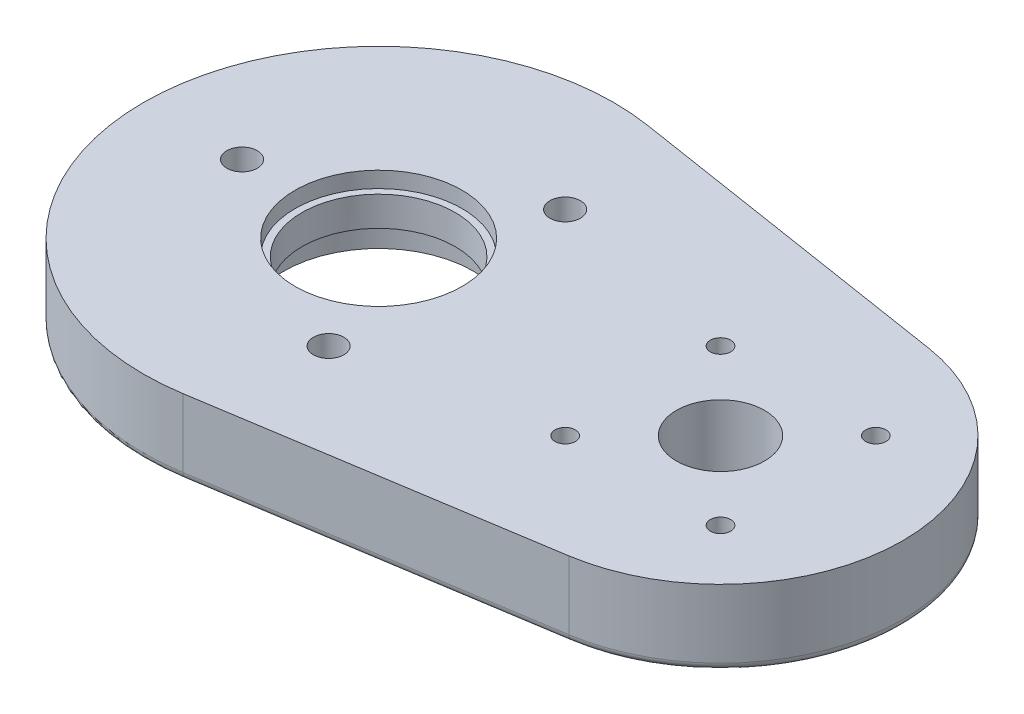
from build123d import *

# Parameters (mm, degrees)
BOSS_EXTRUDE1_DEPTH                          = 12.7
SKETCH2_R                                    = 12.827
SKETCH2_R_2                                  = 7.366
CUT_EXTRUDE1_DEPTH                           = 106.08145771
CBORE_FOR_10_SOCKET_HEAD_CAP_SCREW1_AT_COUNT = 2
CBORE_FOR_10_SOCKET_HEAD_CAP_SCREW1_AT_PITCH = 39.594681461
CBORE_FOR_10_SOCKET_HEAD_CAP_SCREW1_2_COUNT  = 2
CBORE_FOR_10_SOCKET_HEAD_CAP_SCREW1_2_PITCH  = 39.594681461
CBORE_FOR_M3_SHCS1_AT_2_COUNT                = 2
CBORE_FOR_M3_SHCS1_AT_2_PITCH                = 36.769552622
CBORE_FOR_M3_SHCS1_AT_3_COUNT                = 2
CBORE_FOR_M3_SHCS1_AT_3_PITCH                = 26
CBORE_FOR_M3_SHCS1_AT_4_COUNT                = 2
CBORE_FOR_M3_SHCS1_AT_4_PITCH                = 26
FILLET1_R                                    = 1.27
BEARING_POCKET_START                         = -5.08
SKETCH13_R                                   = 15.875
SKETCH13_R_2                                 = 12.827
BEARING_POCKET_DEPTH                         = 5.08
SKETCH14_R                                   = 13.97
SKETCH14_R_2                                 = 12.827
CUT_EXTRUDE3_DEPTH                           = 2.667


with BuildPart() as part:
    # Sketch1 → Boss-Extrude1 (new body)
    with BuildSketch(Plane(origin=(0, 0, 0), x_dir=(1, 0, 0), z_dir=(0, 1, 0))):
        with BuildLine():
            Line((-51.110132534, 38.892037987), (4.735019973, 30.109964893))
            ThreePointArc((4.735019973, 30.109964893), (30.48, 0), (4.735019973, -30.109964893))
            Line((4.735019973, -30.109964893), (-51.110132534, -38.892037987))
            ThreePointArc((-51.110132534, -38.892037987), (-96.5962, 0), (-51.110132534, 38.892037987))
        make_face()
    extrude(amount=BOSS_EXTRUDE1_DEPTH)

    # Sketch2 → Cut-Extrude1 (cut, through all)
    with BuildSketch(Plane(origin=(0, 12.7, 0), x_dir=(1, 0, 0), z_dir=(0, 1, 0))):
        with Locations((-57.2262, 0)):
            Circle(SKETCH2_R)
        Circle(SKETCH2_R_2)
    extrude(amount=-CUT_EXTRUDE1_DEPTH, mode=Mode.SUBTRACT)

    # Sketch12 → CBORE for #10 Socket Head Cap Screw1 (revolve, cut)
    with BuildSketch(Plane(origin=(-80.0862, 0, 0), x_dir=(0, 0, -1), z_dir=(1, 0, 0))):
        Polygon((0, 0), (0, 12.7), (2.5527, 12.7), (2.5527, 4.826), (4.7625, 4.826), (4.7625, 0.635), (5.3975, 0), align=None)
    cbore_for_10_socket_head_cap_screw1 = revolve(axis=Axis((-80.0862, -6.35, 0), (0, 1, 0)), mode=Mode.SUBTRACT)

    # CBORE for #10 Socket Head Cap Screw1 at: CBORE for #10 Socket Head Cap Screw1 ×2
    with Locations(*[Vector(0.8660254037844389, 0, -0.4999999999999996) * (i * CBORE_FOR_10_SOCKET_HEAD_CAP_SCREW1_AT_PITCH) for i in range(1, CBORE_FOR_10_SOCKET_HEAD_CAP_SCREW1_AT_COUNT)]):
        add(cbore_for_10_socket_head_cap_screw1, mode=Mode.SUBTRACT)

    # CBORE for _10 Socket Head Cap Screw1 2: CBORE for #10 Socket Head Cap Screw1 ×2
    with Locations(*[Vector(0.8660254037844397, 0, 0.4999999999999982) * (i * CBORE_FOR_10_SOCKET_HEAD_CAP_SCREW1_2_PITCH) for i in range(1, CBORE_FOR_10_SOCKET_HEAD_CAP_SCREW1_2_COUNT)]):
        add(cbore_for_10_socket_head_cap_screw1, mode=Mode.SUBTRACT)

    # Sketch16 → CBORE for M3 SHCS1 (revolve, cut)
    with BuildSketch(Plane(origin=(-13, 0, -13), x_dir=(0, 0, -1), z_dir=(1, 0, 0))):
        Polygon((0, 0), (0, 12.7), (1.7, 12.7), (1.7, 3), (3.25, 3), (3.25, 0.75), (4, 0), align=None)
    cbore_for_m3_shcs1 = revolve(axis=Axis((-13, -6.35, -13), (0, 1, 0)), mode=Mode.SUBTRACT)

    # CBORE for M3 SHCS1 at 2: CBORE for M3 SHCS1 ×2
    with Locations(*[Vector(0.7071067811865476, 0, 0.7071067811865476) * (i * CBORE_FOR_M3_SHCS1_AT_2_PITCH) for i in range(1, CBORE_FOR_M3_SHCS1_AT_2_COUNT)]):
        add(cbore_for_m3_shcs1, mode=Mode.SUBTRACT)

    # CBORE for M3 SHCS1 at 3: CBORE for M3 SHCS1 ×2
    with Locations(*[(i * CBORE_FOR_M3_SHCS1_AT_3_PITCH, 0, 0) for i in range(1, CBORE_FOR_M3_SHCS1_AT_3_COUNT)]):
        add(cbore_for_m3_shcs1, mode=Mode.SUBTRACT)

    # CBORE for M3 SHCS1 at 4: CBORE for M3 SHCS1 ×2
    with Locations(*[(0, 0, i * CBORE_FOR_M3_SHCS1_AT_4_PITCH) for i in range(1, CBORE_FOR_M3_SHCS1_AT_4_COUNT)]):
        add(cbore_for_m3_shcs1, mode=Mode.SUBTRACT)

    # Fillet1
    fillet1_edges = [part.edges().sort_by_distance(p)[0] for p in [
        (-96.5962, 0, 0),
        (-23.187556281, 0, -34.50100144),
        (30.48, 0, 0),
        (-7.366, 0, 0),
        (-23.187556281, 0, 34.50100144),
    ]]
    fillet(fillet1_edges, radius=FILLET1_R)

    # Sketch13 → bearing_pocket (cut)
    with BuildSketch(Plane.XZ.offset(BEARING_POCKET_START)):
        with Locations((-57.2262, 0)):
            Circle(SKETCH13_R)
        with Locations((-57.2262, 0)):
            Circle(SKETCH13_R_2, mode=Mode.SUBTRACT)
    extrude(amount=BEARING_POCKET_DEPTH, mode=Mode.SUBTRACT)

    # Sketch14 → Cut-Extrude3 (cut)
    with BuildSketch(Plane(origin=(0, 12.7, 0), x_dir=(1, 0, 0), z_dir=(0, 1, 0))):
        with Locations((-57.2262, 0)):
            Circle(SKETCH14_R)
        with Locations((-57.2262, 0)):
            Circle(SKETCH14_R_2, mode=Mode.SUBTRACT)
    extrude(amount=-CUT_EXTRUDE3_DEPTH, mode=Mode.SUBTRACT)


solid = part.part
